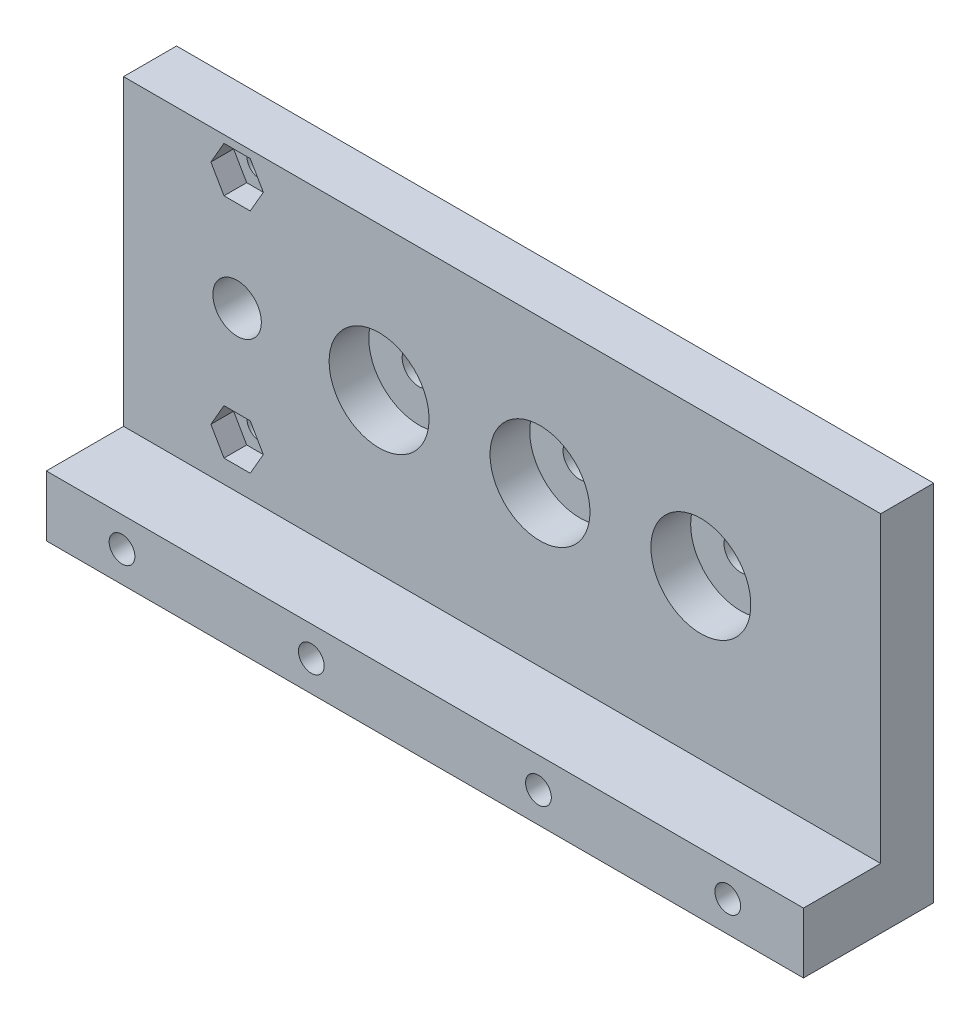
from build123d import *

# Parameters (mm, degrees)
SKETCH1_W           = 100
SKETCH1_H           = 48
BOSS_EXTRUDE1_DEPTH = 7
CUT_EXTRUDE1_REACH  = 113.144
SKETCH2_R           = 3.2
SKETCH2_R_2         = 2.2
SKETCH3_W           = 100
SKETCH3_H           = 8
BOSS_EXTRUDE2_DEPTH = 10.2
SKETCH4_R           = 6.6
CUT_EXTRUDE2_DEPTH  = 5.25
SKETCH5_R           = 2.6
CUT_EXTRUDE3_DEPTH  = 7
SKETCH7_R           = 1.7
CUT_EXTRUDE4_DEPTH  = 112.391382072
CUT_EXTRUDE5_REACH  = 114.249
SKETCH8_R           = 1.7
CUT_EXTRUDE6_DEPTH  = 3
CUT_EXTRUDE7_REACH  = 114.249
SKETCH10_R          = 1.7
CUT_EXTRUDE8_DEPTH  = 3


with BuildPart() as part:
    # Sketch1 → Boss-Extrude1 (new body)
    with BuildSketch(Plane.XY):
        with Locations((50, 24)):
            Rectangle(SKETCH1_W, SKETCH1_H)
    extrude(amount=BOSS_EXTRUDE1_DEPTH)

    # Sketch2 → Cut-Extrude1 (cut, up to next)
    with BuildSketch(Plane.XY.offset(7), mode=Mode.PRIVATE) as cut_extrude1_sk1:
        with Locations((15, 29)):
            Circle(SKETCH2_R)
    cut_extrude1_tool1 = extrude(cut_extrude1_sk1.sketch, amount=-CUT_EXTRUDE1_REACH, mode=Mode.PRIVATE) & part.part
    # Sketch2 → Cut-Extrude1 (cut, up to next)
    with BuildSketch(Plane.XY.offset(7), mode=Mode.PRIVATE) as cut_extrude1_sk2:
        with Locations((33.75, 29)):
            Circle(SKETCH2_R_2)
    cut_extrude1_tool2 = extrude(cut_extrude1_sk2.sketch, amount=-CUT_EXTRUDE1_REACH, mode=Mode.PRIVATE) & part.part
    # Sketch2 → Cut-Extrude1 (cut, up to next)
    with BuildSketch(Plane.XY.offset(7), mode=Mode.PRIVATE) as cut_extrude1_sk3:
        with Locations((55, 29)):
            Circle(SKETCH2_R_2)
    cut_extrude1_tool3 = extrude(cut_extrude1_sk3.sketch, amount=-CUT_EXTRUDE1_REACH, mode=Mode.PRIVATE) & part.part
    # Sketch2 → Cut-Extrude1 (cut, up to next)
    with BuildSketch(Plane.XY.offset(7), mode=Mode.PRIVATE) as cut_extrude1_sk4:
        with Locations((76.25, 29)):
            Circle(SKETCH2_R_2)
    cut_extrude1_tool4 = extrude(cut_extrude1_sk4.sketch, amount=-CUT_EXTRUDE1_REACH, mode=Mode.PRIVATE) & part.part
    add(cut_extrude1_tool1.solids().sort_by_distance((15, 29, 7))[0], mode=Mode.SUBTRACT)
    add(cut_extrude1_tool2.solids().sort_by_distance((33.75, 29, 7))[0], mode=Mode.SUBTRACT)
    add(cut_extrude1_tool3.solids().sort_by_distance((55, 29, 7))[0], mode=Mode.SUBTRACT)
    add(cut_extrude1_tool4.solids().sort_by_distance((76.25, 29, 7))[0], mode=Mode.SUBTRACT)

    # Sketch3 → Boss-Extrude2 (add)
    with BuildSketch(Plane(origin=(0, 0, 0), x_dir=(-1, 0, 0), z_dir=(0, 0, -1))):
        with Locations((-50, 4)):
            Rectangle(SKETCH3_W, SKETCH3_H)
    extrude(amount=BOSS_EXTRUDE2_DEPTH)

    # Sketch4 → Cut-Extrude2 (cut)
    with BuildSketch(Plane(origin=(0, 0, 0), x_dir=(-1, 0, 0), z_dir=(0, 0, -1))):
        with Locations((-76.25, 29)):
            Circle(SKETCH4_R)
        with Locations((-55, 29)):
            Circle(SKETCH4_R)
        with Locations((-33.75, 29)):
            Circle(SKETCH4_R)
    extrude(amount=-CUT_EXTRUDE2_DEPTH, mode=Mode.SUBTRACT)

    # Sketch5 → Cut-Extrude3 (cut)
    with BuildSketch(Plane.XY.offset(7)):
        with Locations((35.000022648, 4.052132501)):
            Circle(SKETCH5_R)
        with Locations((64.999977352, 4)):
            Circle(SKETCH5_R)
    extrude(amount=-CUT_EXTRUDE3_DEPTH, mode=Mode.SUBTRACT)

    # Sketch7 → Cut-Extrude4 (cut, through all)
    with BuildSketch(Plane.XY):
        with Locations((35.000022648, 4.052132501)):
            Circle(SKETCH7_R)
        with Locations((64.999977352, 4)):
            Circle(SKETCH7_R)
    extrude(amount=-CUT_EXTRUDE4_DEPTH, mode=Mode.SUBTRACT)

    # Sketch8 → Cut-Extrude5 (cut, up to next)
    with BuildSketch(Plane.XY.offset(7), mode=Mode.PRIVATE) as cut_extrude5_sk1:
        with Locations((10, 4.052132501)):
            Circle(SKETCH8_R)
    cut_extrude5_tool1 = extrude(cut_extrude5_sk1.sketch, amount=-CUT_EXTRUDE5_REACH, mode=Mode.PRIVATE) & part.part
    # Sketch8 → Cut-Extrude5 (cut, up to next)
    with BuildSketch(Plane.XY.offset(7), mode=Mode.PRIVATE) as cut_extrude5_sk2:
        with Locations((90, 4.052132501)):
            Circle(SKETCH8_R)
    cut_extrude5_tool2 = extrude(cut_extrude5_sk2.sketch, amount=-CUT_EXTRUDE5_REACH, mode=Mode.PRIVATE) & part.part
    add(cut_extrude5_tool1.solids().sort_by_distance((10, 4.052133, 7))[0], mode=Mode.SUBTRACT)
    add(cut_extrude5_tool2.solids().sort_by_distance((90, 4.052133, 7))[0], mode=Mode.SUBTRACT)


with BuildPart() as body_2:
    # Mirror1: mirrored copy
    add(part.part.mirror(Plane.XY.offset(-10.2)))

    # Sketch9 → Cut-Extrude6 (cut)
    with BuildSketch(Plane(origin=(0, 0, -27.4), x_dir=(-1, 0, 0), z_dir=(0, 0, -1))):
        Polygon((-88.267949192, 1.052132501), (-86.535898385, 4.052132501), (-88.267949192, 7.052132501), (-91.732050808, 7.052132501), (-93.464101615, 4.052132501), (-91.732050808, 1.052132501), align=None)
        Polygon((-13.464101615, 4.052132501), (-11.732050808, 1.052132501), (-8.267949192, 1.052132501), (-6.535898385, 4.052132501), (-8.267949192, 7.052132501), (-11.732050808, 7.052132501), align=None)
    extrude(amount=-CUT_EXTRUDE6_DEPTH, mode=Mode.SUBTRACT)

    # Sketch10 → Cut-Extrude7 (cut, up to next)
    with BuildSketch(Plane(origin=(0, 0, -27.4), x_dir=(-1, 0, 0), z_dir=(0, 0, -1)), mode=Mode.PRIVATE) as cut_extrude7_sk1:
        with Locations((-15, 44)):
            Circle(SKETCH10_R)
    cut_extrude7_tool1 = extrude(cut_extrude7_sk1.sketch, amount=-CUT_EXTRUDE7_REACH, mode=Mode.PRIVATE) & body_2.part
    # Sketch10 → Cut-Extrude7 (cut, up to next)
    with BuildSketch(Plane(origin=(0, 0, -27.4), x_dir=(-1, 0, 0), z_dir=(0, 0, -1)), mode=Mode.PRIVATE) as cut_extrude7_sk2:
        with Locations((-15, 14)):
            Circle(SKETCH10_R)
    cut_extrude7_tool2 = extrude(cut_extrude7_sk2.sketch, amount=-CUT_EXTRUDE7_REACH, mode=Mode.PRIVATE) & body_2.part
    add(cut_extrude7_tool1.solids().sort_by_distance((15, 44, -27.4))[0], mode=Mode.SUBTRACT)
    add(cut_extrude7_tool2.solids().sort_by_distance((15, 14, -27.4))[0], mode=Mode.SUBTRACT)

    # Sketch11 → Cut-Extrude8 (cut)
    with BuildSketch(Plane.XY.offset(-20.4)):
        Polygon((18.464101615, 44), (16.732050808, 47), (13.267949192, 47), (11.535898385, 44), (13.267949192, 41), (16.732050808, 41), align=None)
        Polygon((18.464101615, 14), (16.732050808, 17), (13.267949192, 17), (11.535898385, 14), (13.267949192, 11), (16.732050808, 11), align=None)
    extrude(amount=-CUT_EXTRUDE8_DEPTH, mode=Mode.SUBTRACT)


solid = body_2.part
